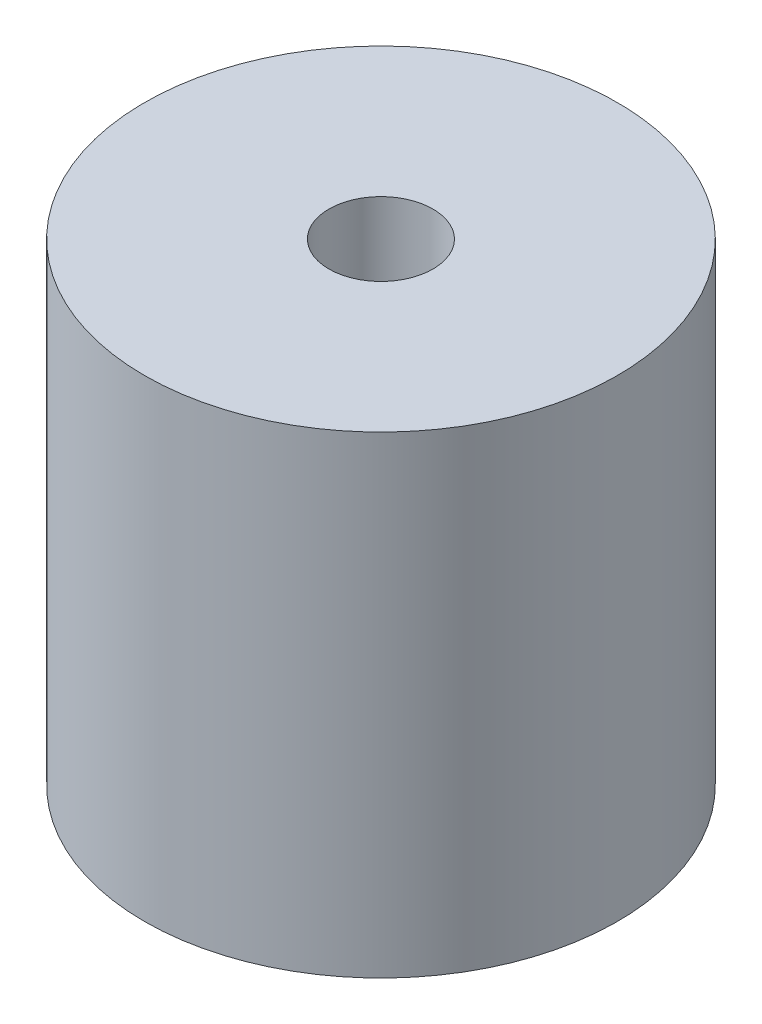
from build123d import *

# Parameters (mm, degrees)
SKETCH_1_R         = 7.5
EXTRUDE_1_DEPTH    = 7.5
HOLE_WIZARD_M4_1_D = 3.3


with BuildPart() as part:
    # 草图1 → 凸台-拉伸1 (new, symmetric)
    with BuildSketch(Plane(origin=(0, 0, 0), x_dir=(1, 0, 0), z_dir=(0, 1, 0))):
        Circle(SKETCH_1_R)
    extrude(amount=EXTRUDE_1_DEPTH, both=True)

    # M4 螺纹孔1 (through all)
    with Locations(Plane(origin=(0, 7.5, 0), x_dir=(1, 0, 0), z_dir=(0, 1, 0))):
        with Locations((0, 0)):
            Hole(HOLE_WIZARD_M4_1_D / 2)


solid = part.part
